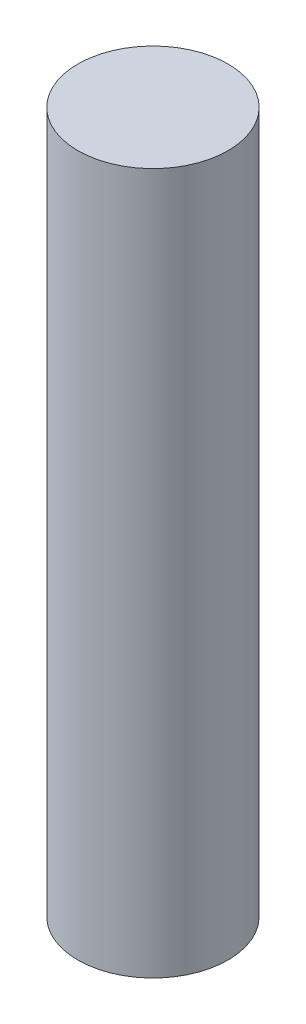
from build123d import *

# Parameters (mm, degrees)
SKETCH1_R           = 15
BOSS_EXTRUDE1_DEPTH = 140


with BuildPart() as part:
    # Sketch1 → Boss-Extrude1 (new body)
    with BuildSketch(Plane(origin=(0, 0, 0), x_dir=(1, 0, 0), z_dir=(0, 1, 0))):
        Circle(SKETCH1_R)
    extrude(amount=BOSS_EXTRUDE1_DEPTH)


solid = part.part
